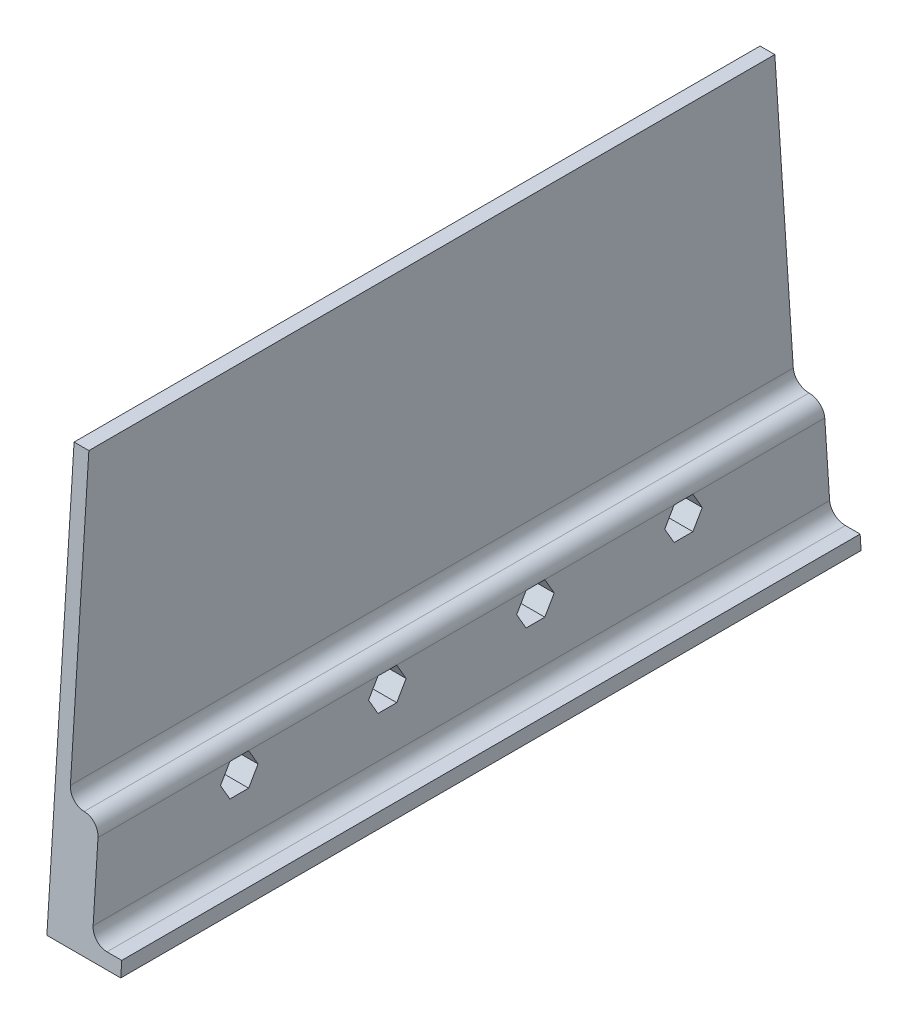
from build123d import *

# Parameters (mm, degrees)
GENERAL_EXTRUDE_DEPTH             = 125.3
ROUNDING_R                        = 5
ROLLER_HOLDERS_DEPTH              = 130.325519523
SKETCH5_W                         = 5
SKETCH5_H                         = 250.6
GUARD_RAIL_DEPTH                  = 100
GUARD_RAIL_SUPPORT_FILLET_R       = 5
SLANT_FOR_INPUT_FROM_SORTER_DEPTH = 175.642749635


with BuildPart() as part:
    # Sketch2 → General extrude (new, symmetric)
    with BuildSketch(Plane.XY):
        Polygon((-12.5, 20), (-12.5, -20), (12.5, -20), (12.5, -15), (2.5, -15), (2.5, 20), align=None)
    extrude(amount=GENERAL_EXTRUDE_DEPTH, both=True)

    # Rounding
    rounding_edges = [part.edges().sort_by_distance(p)[0] for p in [
        (2.5, 20, 0),
        (2.5, -15, 0),
    ]]
    fillet(rounding_edges, radius=ROUNDING_R)

    # Sketch3 → Roller holders (cut, through all)
    with BuildSketch(Plane.ZY.offset(12.5)):
        Polygon((-72.004573519, 4), (-68.829147039, 9.5), (-72.004573519, 15), (-78.355426481, 15), (-81.530852961, 9.5), (-78.355426481, 4), align=None)
        Polygon((-21.884573519, 4), (-18.709147039, 9.5), (-21.884573519, 15), (-28.235426481, 15), (-31.410852961, 9.5), (-28.235426481, 4), align=None)
        Polygon((28.235426481, 4), (31.410852961, 9.5), (28.235426481, 15), (21.884573519, 15), (18.709147039, 9.5), (21.884573519, 4), align=None)
        Polygon((78.355426481, 4), (81.530852961, 9.5), (78.355426481, 15), (72.004573519, 15), (68.829147039, 9.5), (72.004573519, 4), align=None)
    extrude(amount=-ROLLER_HOLDERS_DEPTH, mode=Mode.SUBTRACT)

    # Sketch5 → Guard rail (add)
    with BuildSketch(Plane(origin=(0, 20, 0), x_dir=(1, 0, 0), z_dir=(0, 1, 0))):
        with Locations((-10, 0)):
            Rectangle(SKETCH5_W, SKETCH5_H)
    extrude(amount=GUARD_RAIL_DEPTH)

    # Guard rail support fillet
    guard_rail_support_fillet_edges = [part.edges().sort_by_distance(p)[0] for p in [
        (-7.5, 20, 0),
    ]]
    fillet(guard_rail_support_fillet_edges, radius=GUARD_RAIL_SUPPORT_FILLET_R - 0.0001)  # a hair under: the kernel refuses the full size

    # Sketch6 → Slant for input from sorter (cut, symmetric)
    with BuildSketch(Plane(origin=(-7.5, 0, 0), x_dir=(0, 0, -1), z_dir=(1, 0, 0))):
        Polygon((-125.3, 120), (-125.3, -20), (-116.093807983, 120), align=None)
    slant_for_input_from_sorter = extrude(amount=SLANT_FOR_INPUT_FROM_SORTER_DEPTH, both=True, mode=Mode.SUBTRACT)

    # Mirror of cut above (since same part is used on both sides): Slant for input from sorter across plane
    add(slant_for_input_from_sorter.mirror(Plane.XY), mode=Mode.SUBTRACT)


solid = part.part
